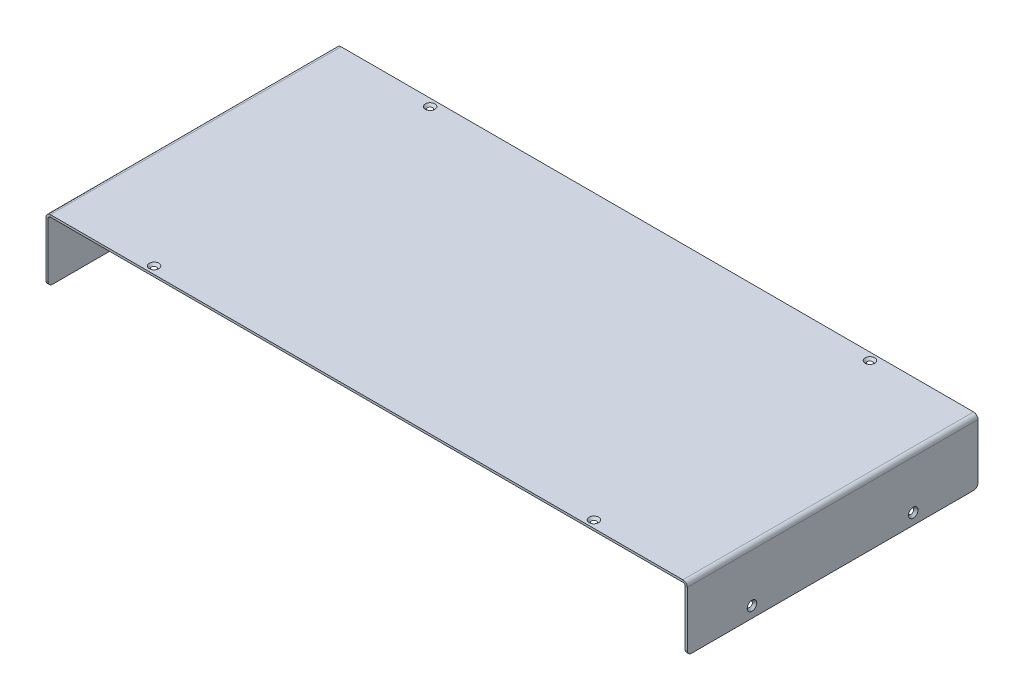
from build123d import *

# Parameters (mm, degrees)
SM_BASE_FLANGE_1_DEPTH = 198.3
FILLET_1_R             = 3
SKETCH_6_R             = 1.65
CUT_EXTRUDE_1_DEPTH    = 299.389242433
CUT_EXTRUDE_2_REACH    = 482.769
SKETCH_7_R             = 1.65
CHAMFER_2_SIZE         = 1.6


# Sheet-metal steps are written as plain solids
with BuildPart() as part:
    # Sketch 1 → Базовая кромка1 (new body)
    with BuildSketch(Plane.XY):
        with BuildLine():
            Line((-217.2, -21.1), (-217.2, 19.3))
            ThreePointArc((-217.2, 19.3), (-216.760660172, 20.360660172), (-215.7, 20.8))
            Line((-215.7, 20.8), (215.7, 20.8))
            ThreePointArc((215.7, 20.8), (216.760660172, 20.360660172), (217.2, 19.3))
            Line((217.2, 19.3), (217.2, -21.1))
            Line((217.2, -21.1), (218.7, -21.1))
            Line((218.7, -21.1), (218.7, 19.3))
            ThreePointArc((218.7, 19.3), (217.821320344, 21.421320344), (215.7, 22.3))
            Line((215.7, 22.3), (-215.7, 22.3))
            ThreePointArc((-215.7, 22.3), (-217.821320344, 21.421320344), (-218.7, 19.3))
            Line((-218.7, 19.3), (-218.7, -21.1))
            Line((-218.7, -21.1), (-217.2, -21.1))
        make_face()
    extrude(amount=SM_BASE_FLANGE_1_DEPTH)

    # Скругление1
    fillet_1_edges = [part.edges().sort_by_distance(p)[0] for p in [
        (-217.95, -21.1, 0),
        (217.95, -21.1, 0),
        (-217.95, -21.1, 198.3),
        (217.95, -21.1, 198.3),
    ]]
    fillet(fillet_1_edges, radius=FILLET_1_R)

    # Эскиз6 → Вырез-Вытянуть1 (cut, through all)
    with BuildSketch(Plane(origin=(0, 22.3, 0), x_dir=(1, 0, 0), z_dir=(0, 1, 0))):
        with Locations(Location((-150, -5, 0), (0, 0, 270))):
            Circle(SKETCH_6_R)
        with Locations(Location((150, -5, 0), (0, 0, 270))):
            Circle(SKETCH_6_R)
    cut_extrude_1 = extrude(amount=-CUT_EXTRUDE_1_DEPTH, mode=Mode.SUBTRACT)

    # Зеркальное отражение1: Вырез-Вытянуть1 across plane
    add(cut_extrude_1.mirror(Plane(origin=(0, 0, 99.15), x_dir=(1, 0, 0), z_dir=(0, 0, -1))), mode=Mode.SUBTRACT)

    # Вырез-Вытянуть2: up to this face of the body (flat: up to its plane)
    cut_extrude_2_end = Plane(part.part.faces().sort_by_distance((-218.7, -0.890578691, 99.15))[0])
    # Эскиз7 → Вырез-Вытянуть2 (cut, up to the picked face)
    with BuildSketch(Plane(origin=(218.7, 0, 0), x_dir=(0, 0, -1), z_dir=(1, 0, 0)), mode=Mode.PRIVATE) as cut_extrude_2_sk1:
        with Locations(Location((-154.15, -13.6, 0), (0, 0, 90))):
            Circle(SKETCH_7_R)
    cut_extrude_2_tool1 = split(extrude(cut_extrude_2_sk1.sketch, amount=-CUT_EXTRUDE_2_REACH, mode=Mode.PRIVATE), bisect_by=cut_extrude_2_end, keep=Keep.BOTH, mode=Mode.PRIVATE)
    # Эскиз7 → Вырез-Вытянуть2 (cut, up to the picked face)
    with BuildSketch(Plane(origin=(218.7, 0, 0), x_dir=(0, 0, -1), z_dir=(1, 0, 0)), mode=Mode.PRIVATE) as cut_extrude_2_sk2:
        with Locations(Location((-44.15, -13.6, 0), (0, 0, 90))):
            Circle(SKETCH_7_R)
    cut_extrude_2_tool2 = split(extrude(cut_extrude_2_sk2.sketch, amount=-CUT_EXTRUDE_2_REACH, mode=Mode.PRIVATE), bisect_by=cut_extrude_2_end, keep=Keep.BOTH, mode=Mode.PRIVATE)
    add(cut_extrude_2_tool1.solids().sort_by(Axis((218.7, -13.6, 154.15), (-1, 0, 0)))[0], mode=Mode.SUBTRACT)
    add(cut_extrude_2_tool2.solids().sort_by(Axis((218.7, -13.6, 44.15), (-1, 0, 0)))[0], mode=Mode.SUBTRACT)

    # Фаска2
    # the kernel refuses this chamfer: 1.6 mm, written as the material it takes off along each edge
    with BuildSketch(Plane(origin=(-218.7, -13.6, 44.15), x_dir=(0, 1, 0), z_dir=(0, 0, -1))) as chamfer_2_piece_1:
        Polygon((1.65 + CHAMFER_2_SIZE, 0), (1.65, CHAMFER_2_SIZE), (1.65, 0), align=None)
    revolve(axis=Axis((-218.7, -13.6, 44.15), (1, 0, 0)), mode=Mode.SUBTRACT)
    with BuildSketch(Plane(origin=(-218.7, -13.6, 154.15), x_dir=(0, 1, 0), z_dir=(0, 0, -1))) as chamfer_2_piece_2:
        Polygon((1.65 + CHAMFER_2_SIZE, 0), (1.65, CHAMFER_2_SIZE), (1.65, 0), align=None)
    revolve(axis=Axis((-218.7, -13.6, 154.15), (1, 0, 0)), mode=Mode.SUBTRACT)
    with BuildSketch(Plane(origin=(-150, 22.3, 193.3), x_dir=(0, 0, -1), z_dir=(-1, 0, 0))) as chamfer_2_piece_3:
        Polygon((1.65 + CHAMFER_2_SIZE, 0), (1.65, CHAMFER_2_SIZE), (1.65, 0), align=None)
    revolve(axis=Axis((-150, 22.3, 193.3), (0, -1, 0)), mode=Mode.SUBTRACT)
    with BuildSketch(Plane(origin=(-150, 22.3, 5), x_dir=(0, 0, 1), z_dir=(-1, 0, 0))) as chamfer_2_piece_4:
        Polygon((1.65 + CHAMFER_2_SIZE, 0), (1.65, -CHAMFER_2_SIZE), (1.65, 0), align=None)
    revolve(axis=Axis((-150, 22.3, 5), (0, 1, 0)), mode=Mode.SUBTRACT)
    with BuildSketch(Plane(origin=(150, 22.3, 5), x_dir=(0, 0, 1), z_dir=(-1, 0, 0))) as chamfer_2_piece_5:
        Polygon((1.65 + CHAMFER_2_SIZE, 0), (1.65, -CHAMFER_2_SIZE), (1.65, 0), align=None)
    revolve(axis=Axis((150, 22.3, 5), (0, 1, 0)), mode=Mode.SUBTRACT)
    with BuildSketch(Plane(origin=(218.7, -13.6, 44.15), x_dir=(0, 1, 0), z_dir=(0, 0, -1))) as chamfer_2_piece_6:
        Polygon((1.65 + CHAMFER_2_SIZE, 0), (1.65, -CHAMFER_2_SIZE), (1.65, 0), align=None)
    revolve(axis=Axis((218.7, -13.6, 44.15), (1, 0, 0)), mode=Mode.SUBTRACT)
    with BuildSketch(Plane(origin=(218.7, -13.6, 154.15), x_dir=(0, 1, 0), z_dir=(0, 0, -1))) as chamfer_2_piece_7:
        Polygon((1.65 + CHAMFER_2_SIZE, 0), (1.65, -CHAMFER_2_SIZE), (1.65, 0), align=None)
    revolve(axis=Axis((218.7, -13.6, 154.15), (1, 0, 0)), mode=Mode.SUBTRACT)
    with BuildSketch(Plane(origin=(150, 22.3, 193.3), x_dir=(0, 0, -1), z_dir=(-1, 0, 0))) as chamfer_2_piece_8:
        Polygon((1.65 + CHAMFER_2_SIZE, 0), (1.65, CHAMFER_2_SIZE), (1.65, 0), align=None)
    revolve(axis=Axis((150, 22.3, 193.3), (0, -1, 0)), mode=Mode.SUBTRACT)


solid = part.part
